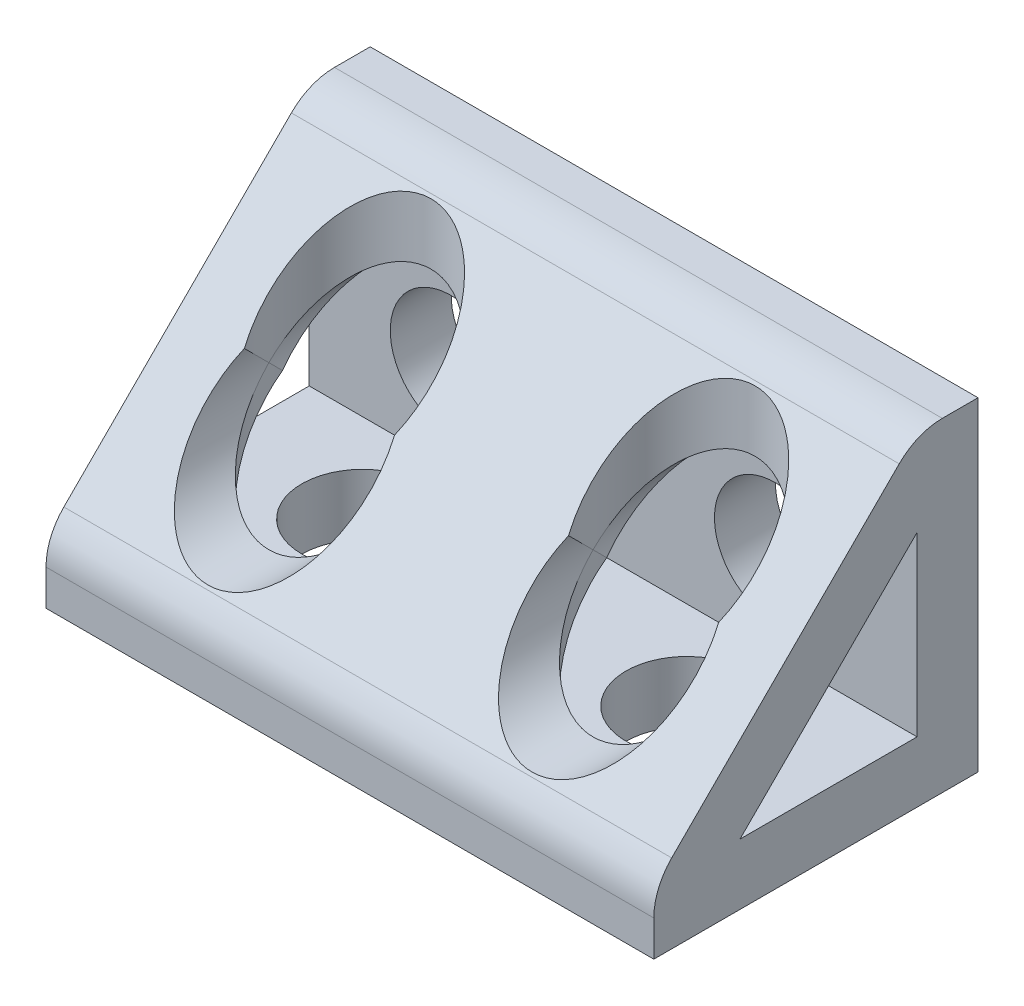
from build123d import *

# Parameters (mm, degrees)
BOSS_EXTRUDE1_START     = -20.6248
BOSS_EXTRUDE1_OUTLINE_W = 47.625
BOSS_EXTRUDE1_OUTLINE_H = 20.6248
BOSS_EXTRUDE1_DEPTH     = 25.4
BOSS_EXTRUDE1_2_DEPTH   = 4.7752
BOSS_EXTRUDE1_START_2   = 4.7752
BOSS_EXTRUDE1_3_DEPTH   = 20.6248
BOSS_EXTRUDE1_START_3   = -23.8125
BOSS_EXTRUDE1_4_DEPTH   = 47.625
SKETCH2_W               = 47.625
SKETCH2_H               = 25.4
BOSS_EXTRUDE2_DEPTH     = 4.7752
FILLET1_R               = 4.7752
SKETCH4_R               = 4.7625
CUT_EXTRUDE1_DEPTH      = 41.466993109
SKETCH5_R               = 4.7625
CUT_EXTRUDE2_DEPTH      = 41.466993109


with BuildPart() as part:
    # Boss-Extrude1: read off the stored shape, not the designer's step
    # Boss-Extrude1 outline → Boss-Extrude1 (new body)
    with BuildSketch(Plane.XZ.offset(-4.7752).offset(BOSS_EXTRUDE1_START)):
        with Locations((0, 15.0876)):
            Rectangle(BOSS_EXTRUDE1_OUTLINE_W, BOSS_EXTRUDE1_OUTLINE_H)
        with BuildLine():
            ThreePointArc((-18.972513521, 11.711023698), (-12.7, 19.05), (-6.427486479, 11.711023698))
            ThreePointArc((-6.427486479, 11.711023698), (-12.7, 6.35), (-18.972513521, 11.711023698))
        make_face(mode=Mode.SUBTRACT)
        with BuildLine():
            ThreePointArc((6.427486479, 11.711023698), (12.7, 19.05), (18.972513521, 11.711023698))
            ThreePointArc((18.972513521, 11.711023698), (12.7, 6.35), (6.427486479, 11.711023698))
        make_face(mode=Mode.SUBTRACT)
    extrude(amount=BOSS_EXTRUDE1_DEPTH)

    # Boss-Extrude1 2 outline → Boss-Extrude1 2 (add)
    with BuildSketch(Plane.XZ.offset(-4.7752)):
        with BuildLine():
            ThreePointArc((-18.972513521, 11.711023698), (-12.7, 6.35), (-6.427486479, 11.711023698))
            ThreePointArc((-6.427486479, 11.711023698), (-12.7, 19.05), (-18.972513521, 11.711023698))
        make_face()
        with BuildLine():
            ThreePointArc((6.427486479, 11.711023698), (12.7, 6.35), (18.972513521, 11.711023698))
            ThreePointArc((18.972513521, 11.711023698), (12.7, 19.05), (6.427486479, 11.711023698))
        make_face()
    extrude(amount=BOSS_EXTRUDE1_2_DEPTH)

    # Boss-Extrude1 3 outline → Boss-Extrude1 3 (cut)
    with BuildSketch(Plane.XY.offset(BOSS_EXTRUDE1_START_2)):
        with BuildLine():
            ThreePointArc((18.972513521, 11.711023698), (12.7, 19.05), (6.427486479, 11.711023698))
            ThreePointArc((6.427486479, 11.711023698), (12.7, 6.35), (18.972513521, 11.711023698))
        make_face()
        with BuildLine():
            ThreePointArc((-6.427486479, 11.711023698), (-12.7, 19.05), (-18.972513521, 11.711023698))
            ThreePointArc((-18.972513521, 11.711023698), (-12.7, 6.35), (-6.427486479, 11.711023698))
        make_face()
    extrude(amount=BOSS_EXTRUDE1_3_DEPTH, mode=Mode.SUBTRACT)

    # Boss-Extrude1 4 outline → Boss-Extrude1 4 (cut)
    with BuildSketch(Plane.YZ.offset(BOSS_EXTRUDE1_START_3)):
        Polygon((25.4, 25.4), (4.7752, 25.4), (25.4, 4.7752), align=None)
        Polygon((4.7752, 4.7752), (18.646847397, 4.7752), (4.7752, 18.646847397), align=None)
    extrude(amount=BOSS_EXTRUDE1_4_DEPTH, mode=Mode.SUBTRACT)

    # Sketch2 → Boss-Extrude2 (add)
    with BuildSketch(Plane(origin=(0, 0, 4.7752), x_dir=(-1, 0, 0), z_dir=(0, 0, -1))):
        with Locations((0, 12.7)):
            Rectangle(SKETCH2_W, SKETCH2_H)
    extrude(amount=BOSS_EXTRUDE2_DEPTH)

    # Fillet1
    fillet1_edges = [part.edges().sort_by_distance(p)[0] for p in [
        (0, 25.4, 4.7752),
        (0, 4.7752, 25.4),
    ]]
    fillet(fillet1_edges, radius=FILLET1_R)

    # Sketch4 → Cut-Extrude1 (cut, through all)
    with BuildSketch(Plane.XY.offset(4.7752)):
        with Locations((-12.7, 11.71067)):
            Circle(SKETCH4_R)
        with Locations(Location((12.7, 11.71067, 0), (0, 0, 180))):
            Circle(SKETCH4_R)
    extrude(amount=-CUT_EXTRUDE1_DEPTH, mode=Mode.SUBTRACT)

    # Sketch5 → Cut-Extrude2 (cut, through all)
    with BuildSketch(Plane(origin=(0, 4.7752, 0), x_dir=(1, 0, 0), z_dir=(0, 1, 0))):
        with Locations(Location((-12.7, -11.71067, 0), (0, 0, 270))):
            Circle(SKETCH5_R)
        with Locations(Location((12.7, -11.71067, 0), (0, 0, 90))):
            Circle(SKETCH5_R)
    extrude(amount=-CUT_EXTRUDE2_DEPTH, mode=Mode.SUBTRACT)


solid = part.part
